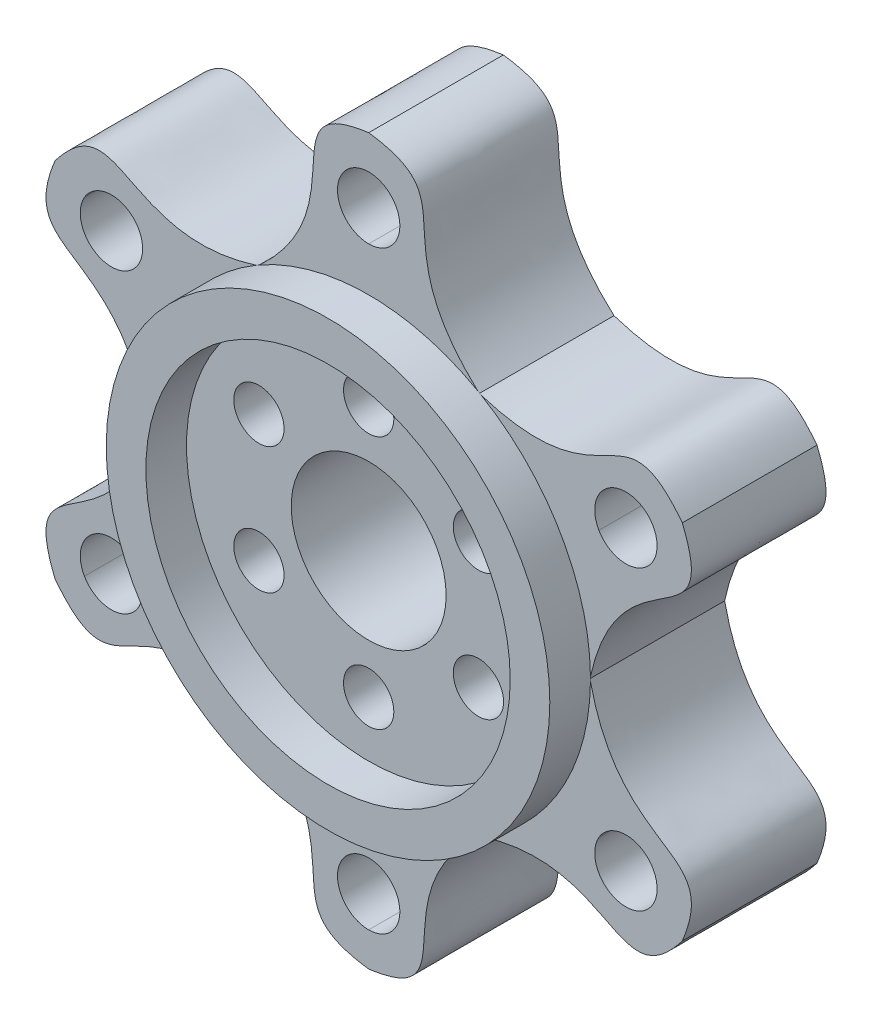
from build123d import *

# Parameters (mm, degrees)
SKETCH1_R           = 45.72
SKETCH1_R_2         = 9.779
SKETCH1_R_3         = 3.175
SKETCH1_R_4         = 3.937
BOSS_EXTRUDE3_DEPTH = 17.000000036
CUT_EXTRUDE1_START  = -22.86
CUT_EXTRUDE1_DEPTH  = 22.86
SKETCH4_R           = 28
SKETCH4_R_2         = 23
BOSS_EXTRUDE4_DEPTH = 5.1308


with BuildPart() as part:
    # Sketch1 → Boss-Extrude3 (new body)
    with BuildSketch(Plane.XY):
        Circle(SKETCH1_R)
        Circle(SKETCH1_R_2, mode=Mode.SUBTRACT)
        with Locations((0, 16.002)):
            Circle(SKETCH1_R_3, mode=Mode.SUBTRACT)
        with Locations((13.858138511, 8.001)):
            Circle(SKETCH1_R_3, mode=Mode.SUBTRACT)
        with Locations((13.858138511, -8.001)):
            Circle(SKETCH1_R_3, mode=Mode.SUBTRACT)
        with Locations((0, -16.002)):
            Circle(SKETCH1_R_3, mode=Mode.SUBTRACT)
        with Locations((-13.858138511, -8.001)):
            Circle(SKETCH1_R_3, mode=Mode.SUBTRACT)
        with Locations((-13.858138511, 8.001)):
            Circle(SKETCH1_R_3, mode=Mode.SUBTRACT)
        with Locations((0, 37.5)):
            Circle(SKETCH1_R_4, mode=Mode.SUBTRACT)
        with Locations((32.475952642, 18.75)):
            Circle(SKETCH1_R_4, mode=Mode.SUBTRACT)
        with Locations((32.475952642, -18.75)):
            Circle(SKETCH1_R_4, mode=Mode.SUBTRACT)
        with Locations((0, -37.5)):
            Circle(SKETCH1_R_4, mode=Mode.SUBTRACT)
        with Locations((-32.475952642, -18.75)):
            Circle(SKETCH1_R_4, mode=Mode.SUBTRACT)
        with Locations((-32.475952642, 18.75)):
            Circle(SKETCH1_R_4, mode=Mode.SUBTRACT)
    extrude(amount=BOSS_EXTRUDE3_DEPTH)

    # Sketch2 → Cut-Extrude1 (cut)
    with BuildSketch(Plane.XY.offset(17.000000036).offset(CUT_EXTRUDE1_START)):
        with BuildLine():
            ThreePointArc((39.594681461, -22.86), (45.72, 0), (39.594681461, 22.86))
            add(Edge.make_bspline(
                [(27.94, 0), (31.622092251, 17.195322725), (44.628878831, 10.61767176), (39.594681461, 22.86)],
                knots=[0, 0, 0, 0, 1, 1, 1, 1], degree=3))
            add(Edge.make_bspline(
                [(27.94, 0), (31.622092251, -17.195322725), (44.628878831, -10.61767176), (39.594681461, -22.86)],
                knots=[0, 0, 0, 0, 1, 1, 1, 1], degree=3))
        make_face()
        with BuildLine():
            add(Edge.make_bspline(
                [(13.97, 24.196749782), (30.702632431, 18.787873847), (31.509612889, 33.34090693), (39.594681461, 22.86)],
                knots=[0, 0, 0, 0, 1, 1, 1, 1], degree=3))
            ThreePointArc((39.594681461, 22.86), (22.86, 39.594681461), (0, 45.72))
            add(Edge.make_bspline(
                [(13.97, 24.196749782), (0.919459819, 35.983196572), (13.119265943, 43.95857869), (0, 45.72)],
                knots=[0, 0, 0, 0, 1, 1, 1, 1], degree=3))
        make_face()
        with BuildLine():
            ThreePointArc((0, -45.72), (22.86, -39.594681461), (39.594681461, -22.86))
            add(Edge.make_bspline(
                [(13.97, -24.196749782), (30.702632431, -18.787873847), (31.509612889, -33.34090693), (39.594681461, -22.86)],
                knots=[0, 0, 0, 0, 1, 1, 1, 1], degree=3))
            add(Edge.make_bspline(
                [(13.97, -24.196749782), (0.919459819, -35.983196572), (13.119265943, -43.95857869), (0, -45.72)],
                knots=[0, 0, 0, 0, 1, 1, 1, 1], degree=3))
        make_face()
        with BuildLine():
            add(Edge.make_bspline(
                [(-13.97, 24.196749782), (-0.919459819, 35.983196572), (-13.119265943, 43.95857869), (0, 45.72)],
                knots=[0, 0, 0, 0, 1, 1, 1, 1], degree=3))
            ThreePointArc((0, 45.72), (-22.86, 39.594681461), (-39.594681461, 22.86))
            add(Edge.make_bspline(
                [(-13.97, 24.196749782), (-30.702632431, 18.787873847), (-31.509612889, 33.34090693), (-39.594681461, 22.86)],
                knots=[0, 0, 0, 0, 1, 1, 1, 1], degree=3))
        make_face()
        with BuildLine():
            ThreePointArc((-39.594681461, -22.86), (-22.86, -39.594681461), (0, -45.72))
            add(Edge.make_bspline(
                [(-13.97, -24.196749782), (-0.919459819, -35.983196572), (-13.119265943, -43.95857869), (0, -45.72)],
                knots=[0, 0, 0, 0, 1, 1, 1, 1], degree=3))
            add(Edge.make_bspline(
                [(-13.97, -24.196749782), (-30.702632431, -18.787873847), (-31.509612889, -33.34090693), (-39.594681461, -22.86)],
                knots=[0, 0, 0, 0, 1, 1, 1, 1], degree=3))
        make_face()
        with BuildLine():
            add(Edge.make_bspline(
                [(-27.94, 0), (-31.622092251, 17.195322725), (-44.628878831, 10.61767176), (-39.594681461, 22.86)],
                knots=[0, 0, 0, 0, 1, 1, 1, 1], degree=3))
            ThreePointArc((-39.594681461, 22.86), (-45.72, 0), (-39.594681461, -22.86))
            add(Edge.make_bspline(
                [(-27.94, 0), (-31.622092251, -17.195322725), (-44.628878831, -10.61767176), (-39.594681461, -22.86)],
                knots=[0, 0, 0, 0, 1, 1, 1, 1], degree=3))
        make_face()
    extrude(amount=CUT_EXTRUDE1_DEPTH, mode=Mode.SUBTRACT)

    # Sketch4 → Boss-Extrude4 (add)
    with BuildSketch(Plane.XY.offset(17.000000036)):
        Circle(SKETCH4_R)
        Circle(SKETCH4_R_2, mode=Mode.SUBTRACT)
    extrude(amount=BOSS_EXTRUDE4_DEPTH)


solid = part.part
